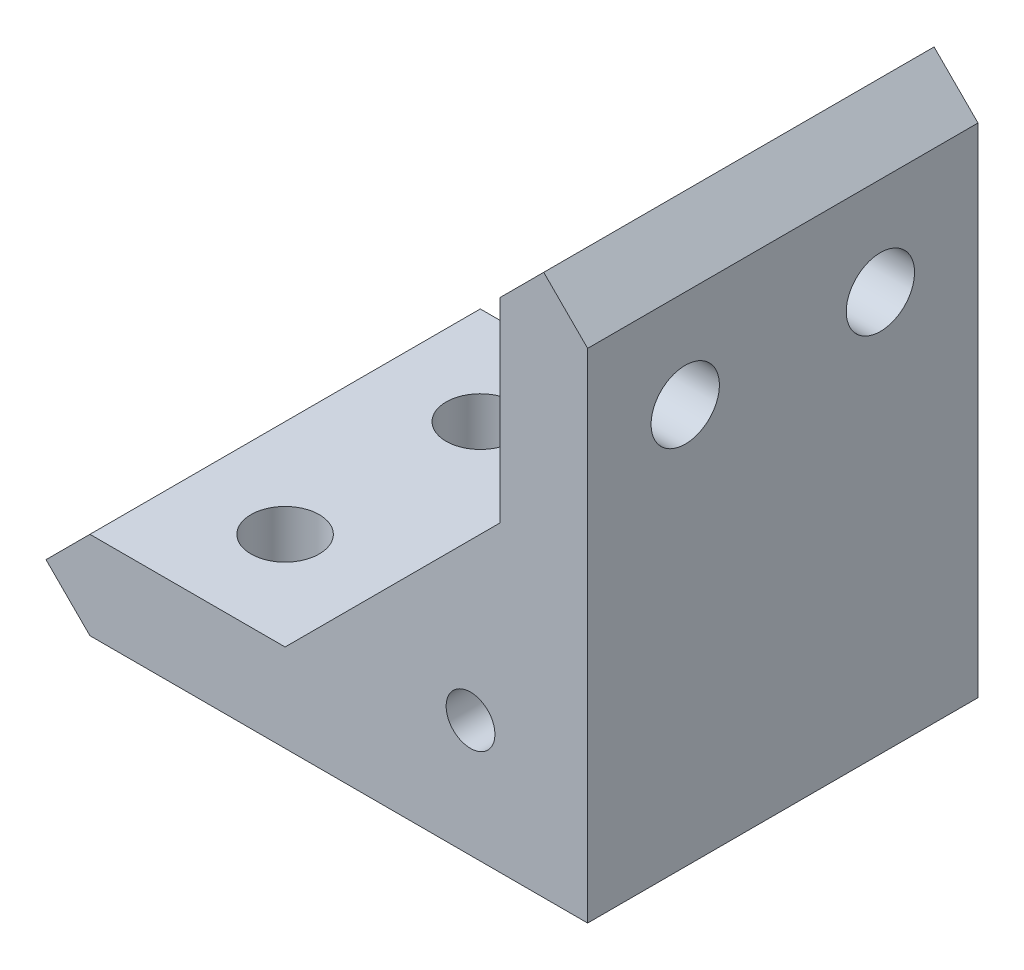
from build123d import *

# Parameters (mm, degrees)
BOSS_EXTRUDE1_DEPTH = 40
SKETCH2_R           = 3.5
CUT_EXTRUDE1_DEPTH  = 84.3366666
SKETCH3_R           = 3.5
CUT_EXTRUDE2_DEPTH  = 40
CHAMFER1_SIZE       = 5
SKETCH4_R           = 2.5
CUT_EXTRUDE3_DEPTH  = 40


with BuildPart() as part:
    # Sketch1 → Boss-Extrude1 (new body)
    with BuildSketch(Plane.XY):
        Polygon((0, 56), (0, 0), (-56, 0), (-56, 9), (-31, 9), (-9, 31), (-9, 56), align=None)
    extrude(amount=BOSS_EXTRUDE1_DEPTH)

    # Sketch2 → Cut-Extrude1 (cut, through all)
    with BuildSketch(Plane.ZY.offset(9)):
        with Locations((10, 41)):
            Circle(SKETCH2_R)
        with Locations((30, 41)):
            Circle(SKETCH2_R)
    extrude(amount=-CUT_EXTRUDE1_DEPTH, mode=Mode.SUBTRACT)

    # Sketch3 → Cut-Extrude2 (cut)
    with BuildSketch(Plane(origin=(0, 9, 0), x_dir=(1, 0, 0), z_dir=(0, 1, 0))):
        with Locations(Location((-41, -10, 0), (0, 0, 270))):
            Circle(SKETCH3_R)
        with Locations(Location((-41, -30, 0), (0, 0, 270))):
            Circle(SKETCH3_R)
    extrude(amount=-CUT_EXTRUDE2_DEPTH, mode=Mode.SUBTRACT)

    # Chamfer1
    # the kernel refuses this chamfer: 5 mm, written as the material it takes off along each edge
    with BuildSketch(Plane(origin=(-56, 0, -12.85841494), x_dir=(0.9996219169112968, -0.027495876610586254, 0), z_dir=(0, 0, 1)), Plane(origin=(-56, 9, -12.85841494), x_dir=(-0.027495876610586317, -0.9996219169112968, 0), z_dir=(0, 0, 1))) as chamfer1_piece_1:
        Polygon((CHAMFER1_SIZE * 0.999621916911, CHAMFER1_SIZE * 0.0274958766106), (-CHAMFER1_SIZE * 0.0274958766106, CHAMFER1_SIZE * 0.999621916911), (0, 0), align=None)
    extrude(amount=65.71682988, mode=Mode.SUBTRACT)
    with BuildSketch(Plane(origin=(0, 56, -12.85841494), x_dir=(0.02749587661058641, -0.9996219169112968, 0), z_dir=(0, 0, 1)), Plane(origin=(-9, 56, -12.85841494), x_dir=(0.9996219169112968, 0.027495876610586317, 0), z_dir=(0, 0, 1))) as chamfer1_piece_2:
        Polygon((CHAMFER1_SIZE * 0.999621916911, -CHAMFER1_SIZE * 0.0274958766106), (-CHAMFER1_SIZE * 0.0274958766106, -CHAMFER1_SIZE * 0.999621916911), (0, 0), align=None)
    extrude(amount=65.71682988, mode=Mode.SUBTRACT)

    # Sketch4 → Cut-Extrude3 (cut)
    with BuildSketch(Plane(origin=(0, 0, 0), x_dir=(-1, 0, 0), z_dir=(0, 0, -1))):
        with Locations((12, 12)):
            Circle(SKETCH4_R)
    extrude(amount=-CUT_EXTRUDE3_DEPTH, mode=Mode.SUBTRACT)


solid = part.part
